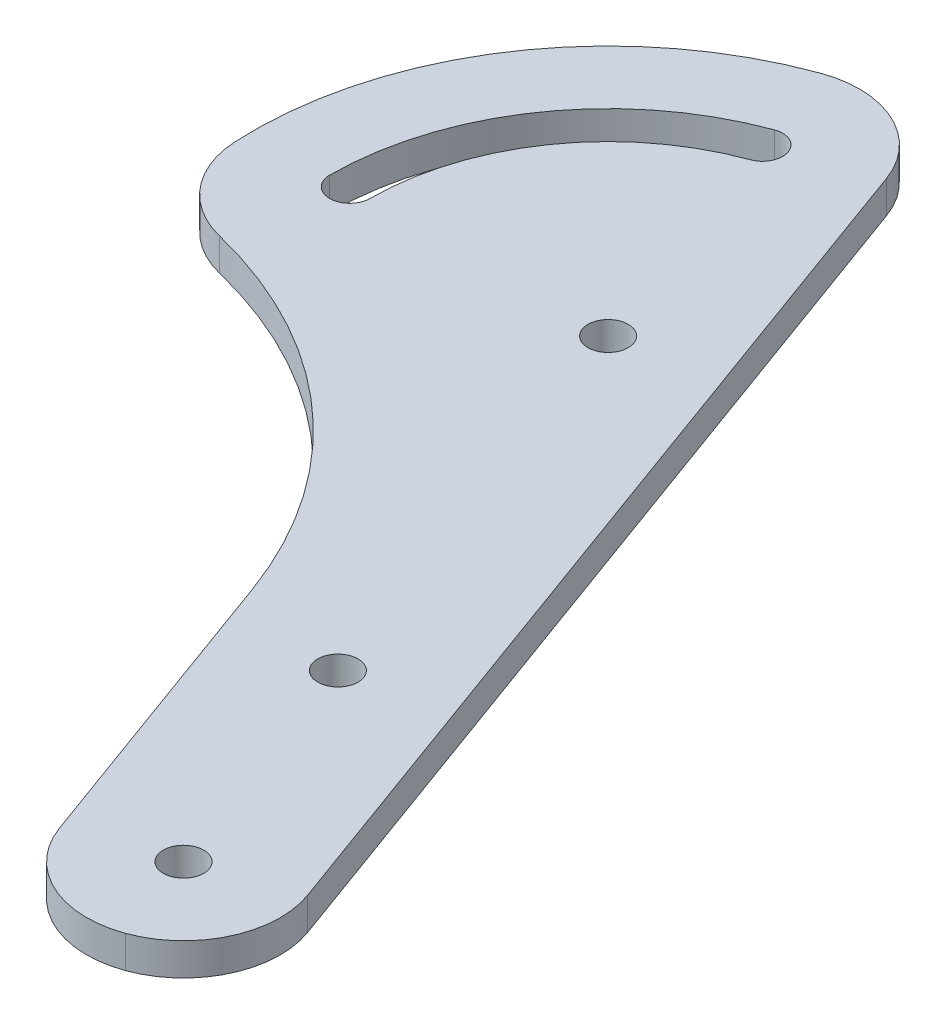
from build123d import *

# Parameters (mm, degrees)
BOSS_EXTRUDE3_DEPTH            = 6.35
F_5_16_0_3125_DIAMETER_HOLE2_D = 7.9375
FILLET2_R                      = 19.05


with BuildPart() as part:
    # Sketch1 → Boss-Extrude3 (new body)
    with BuildSketch(Plane(origin=(0, 0, 0), x_dir=(1, 0, 0), z_dir=(0, 1, 0))):
        with BuildLine():
            Line((160.560790495, -59.070061434), (188.794553327, -136.64168728))
            Line((188.794553327, -136.64168728), (224.596842179, -123.610719819))
            Line((224.596842179, -123.610719819), (196.363079347, -46.039093974))
            Line((196.363079347, -46.039093974), (147.316678264, 88.71478551))
            ThreePointArc((147.316678264, 88.71478551), (95.182229706, 59.114314079), (85.197916699, 0))
            ThreePointArc((85.197916699, 0), (131.323386462, -18.761949266), (160.560790495, -59.070061434))
        make_face()
        with BuildLine():
            ThreePointArc((105.56875, 19.05), (114.038085826, 45.911301485), (136.382769163, 63.056980047))
            ThreePointArc((136.382769163, 63.056980047), (138.754781808, 68.14377758), (133.667984275, 70.515790225))
            ThreePointArc((133.667984275, 70.515790225), (107.536066474, 50.464064448), (97.63125, 19.05))
            ThreePointArc((97.63125, 19.05), (101.6, 15.08125), (105.56875, 19.05))
        make_face(mode=Mode.SUBTRACT)
    extrude(amount=BOSS_EXTRUDE3_DEPTH)

    # 5/16 (0.3125) Diameter Hole2 (through all)
    with Locations(Plane(origin=(0, 6.35, 0), x_dir=(1, 0, 0), z_dir=(0, 1, 0))):
        with Locations((152.4, 19.05), (182.805590742, -64.488673988), (200.180214023, -112.225059124)):
            Hole(F_5_16_0_3125_DIAMETER_HOLE2_D / 2)

    # Fillet2
    fillet2_edges = [part.edges().sort_by_distance(p)[0] for p in [
        (147.316678264, 3.175, -88.71478551),
        (224.596842179, 3.175, 123.610719819),
        (188.794553327, 3.175, 136.64168728),
        (85.197916699, 3.175, 0),
    ]]
    fillet(fillet2_edges, radius=FILLET2_R - 0.0001)  # a hair under: the kernel refuses the full size


solid = part.part
